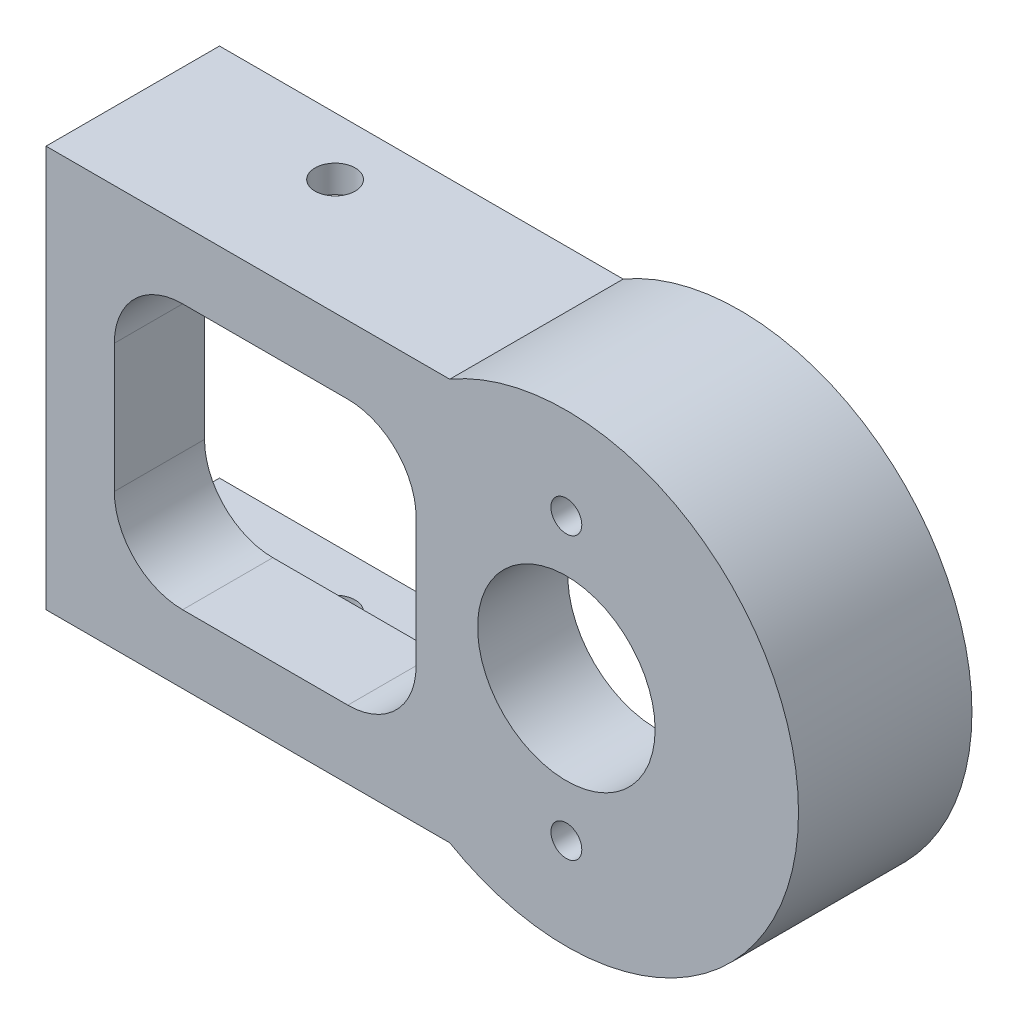
from build123d import *

# Parameters (mm, degrees)
SKETCH2_R               = 6.5
SKETCH2_R_2             = 1.1303
SKETCH2_W               = 22.1
SKETCH2_H               = 19.4
BOSS_EXTRUDE1_DEPTH     = 12.7
CUT_EXTRUDE1_DEPTH      = 6.096
FILLET1_R               = 5
CUT_EXTRUDE2_DEPTH      = 52.164343053
CUT_EXTRUDE2_DEPTH_BACK = 52.164343053
SKETCH3_R               = 1.4732


with BuildPart() as part:
    # Sketch2 → Boss-Extrude1 (new body)
    with BuildSketch(Plane.XY):
        with BuildLine():
            Line((-38.1, -14.7), (-38.1, 14.7))
            Line((-38.1, 14.7), (-8.538735269, 14.7))
            ThreePointArc((-8.538735269, 14.7), (17, 0), (-8.538735269, -14.7))
            Line((-8.538735269, -14.7), (-38.1, -14.7))
        make_face()
        Circle(SKETCH2_R, mode=Mode.SUBTRACT)
        with Locations((0, -10.294657794)):
            Circle(SKETCH2_R_2, mode=Mode.SUBTRACT)
        with Locations((0, 10.294657794)):
            Circle(SKETCH2_R_2, mode=Mode.SUBTRACT)
        with Locations((-22.05, 0)):
            Rectangle(SKETCH2_W, SKETCH2_H, mode=Mode.SUBTRACT)
    extrude(amount=BOSS_EXTRUDE1_DEPTH)

    # Sketch1 → Cut-Extrude1 (cut)
    with BuildSketch(Plane.XY):
        with BuildLine():
            Line((-38.1, -12.7), (-38.1, 12.7))
            Line((-38.1, 12.7), (-7.981854421, 12.7))
            ThreePointArc((-7.981854421, 12.7), (15, 0), (-7.981854421, -12.7))
            Line((-7.981854421, -12.7), (-38.1, -12.7))
        make_face()
    extrude(amount=CUT_EXTRUDE1_DEPTH, mode=Mode.SUBTRACT)

    # Fillet1
    fillet1_edges = [part.edges().sort_by_distance(p)[0] for p in [
        (-33.1, 9.7, 9.398),
        (-11, 9.7, 9.398),
        (-33.1, -9.7, 9.398),
        (-11, -9.7, 9.398),
    ]]
    fillet(fillet1_edges, radius=FILLET1_R)

    # Sketch3 → Cut-Extrude2 (cut, two sides: drawn at the far end of the back side and taken through both)
    with BuildSketch(Plane.XZ.offset(14.7).offset(-CUT_EXTRUDE2_DEPTH_BACK)):
        with Locations((-25.4, 4.234450745)):
            Circle(SKETCH3_R)
    extrude(amount=CUT_EXTRUDE2_DEPTH + CUT_EXTRUDE2_DEPTH_BACK, mode=Mode.SUBTRACT)


solid = part.part
